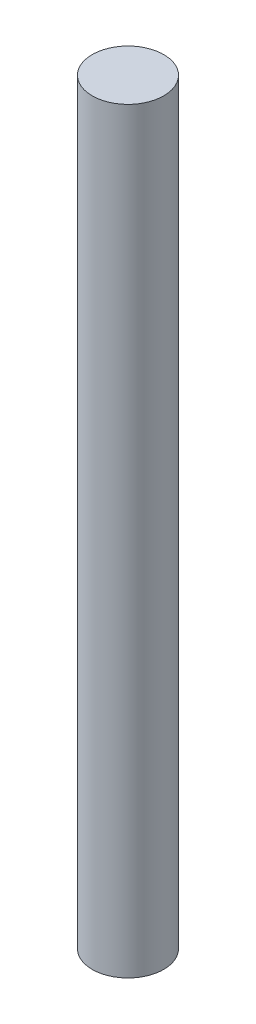
from build123d import *

# Parameters (mm, degrees)
ESQUISSE1_R        = 3.45
BOSS_EXTRU_1_DEPTH = 73


with BuildPart() as part:
    # Esquisse1 → Boss.-Extru.1 (new body)
    with BuildSketch(Plane(origin=(0, 0, 0), x_dir=(1, 0, 0), z_dir=(0, 1, 0))):
        Circle(ESQUISSE1_R)
    extrude(amount=BOSS_EXTRU_1_DEPTH)


solid = part.part
